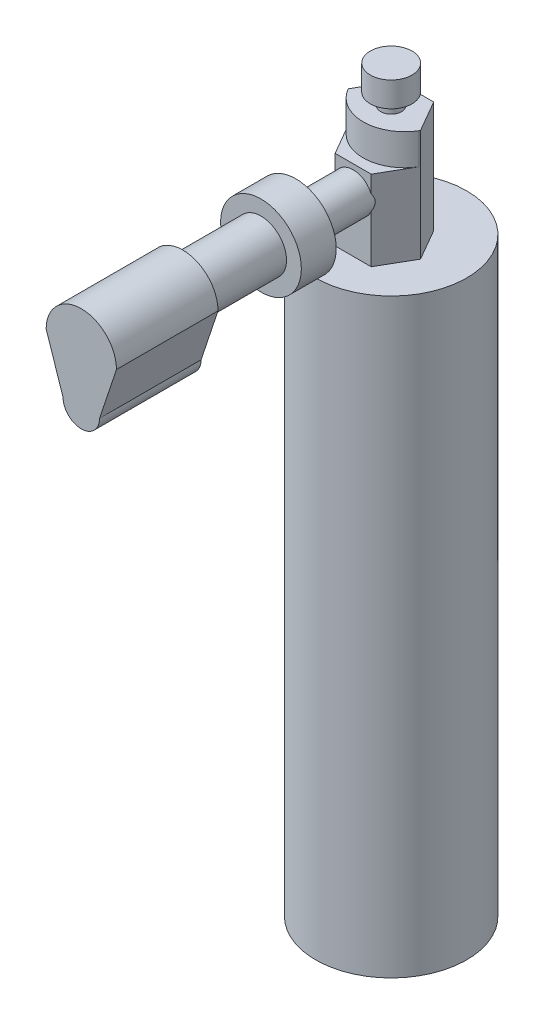
from build123d import *

# Parameters (mm, degrees)
SKETCH1_R                = 14.5
BOSS_EXTRUDE1_DEPTH      = 113.4
SKETCH2_R                = 2
BOSS_EXTRUDE2_DEPTH      = 28.5
SKETCH3_R                = 4
BOSS_EXTRUDE3_DEPTH      = 4.8
BOSS_EXTRUDE4_DEPTH      = 21.4
CUT_EXTRUDE1_DEPTH       = 6
BOSS_EXTRUDE5_DEPTH      = 11
BOSS_EXTRUDE5_DEPTH_BACK = 2
SKETCH7_R                = 3.75
SKETCH8_R                = 7.75
BOSS_EXTRUDE6_DEPTH      = 6.7
SKETCH9_R                = 4.9
BOSS_EXTRUDE7_DEPTH      = 15
BOSS_EXTRUDE8_DEPTH      = 19.5


with BuildPart() as part:
    # Sketch1 → Boss-Extrude1 (new body)
    with BuildSketch(Plane(origin=(0, 0, 0), x_dir=(1, 0, 0), z_dir=(0, 1, 0))):
        Circle(SKETCH1_R)
    extrude(amount=BOSS_EXTRUDE1_DEPTH)

    # Sketch2 → Boss-Extrude2 (add)
    with BuildSketch(Plane(origin=(0, 113.4, 0), x_dir=(1, 0, 0), z_dir=(0, 1, 0))):
        Circle(SKETCH2_R)
    extrude(amount=BOSS_EXTRUDE2_DEPTH)

    # Sketch3 → Boss-Extrude3 (add)
    with BuildSketch(Plane(origin=(0, 141.9, 0), x_dir=(1, 0, 0), z_dir=(0, 1, 0))):
        Circle(SKETCH3_R)
    extrude(amount=-BOSS_EXTRUDE3_DEPTH)

    # Sketch4 → Boss-Extrude4 (add)
    with BuildSketch(Plane(origin=(0, 113.4, 0), x_dir=(1, 0, 0), z_dir=(0, 1, 0))):
        Polygon((3.464101615, 4.7), (-3.464101615, 4.7), (-6.92820323, -1.3), (-3.464101615, -7.3), (3.464101615, -7.3), (6.92820323, -1.3), align=None)
    extrude(amount=BOSS_EXTRUDE4_DEPTH)

    # Sketch6 → Cut-Extrude1 (cut)
    with BuildSketch(Plane(origin=(0, 134.8, 0), x_dir=(1, 0, 0), z_dir=(0, 1, 0))):
        with BuildLine():
            Line((-6.92820323, -1.3), (-6.92820323, -9.46576474))
            Line((-6.92820323, -9.46576474), (6.92820323, -9.46576474))
            Line((6.92820323, -9.46576474), (6.92820323, -1.3))
            ThreePointArc((6.92820323, -1.3), (0, -5.37), (-6.92820323, -1.3))
        make_face()
    extrude(amount=-CUT_EXTRUDE1_DEPTH, mode=Mode.SUBTRACT)

    # Sketch7 → Boss-Extrude5 (add, two sides: drawn at the far end of the back side and taken through both)
    with BuildSketch(Plane.XY.offset(7.3).offset(-BOSS_EXTRUDE5_DEPTH_BACK)):
        with Locations((0, 124.05)):
            Circle(SKETCH7_R)
    extrude(amount=BOSS_EXTRUDE5_DEPTH + BOSS_EXTRUDE5_DEPTH_BACK)

    # Sketch8 → Boss-Extrude6 (add)
    with BuildSketch(Plane.XY.offset(18.3)):
        with Locations((0, 124.05)):
            Circle(SKETCH8_R)
    extrude(amount=BOSS_EXTRUDE6_DEPTH)

    # Sketch9 → Boss-Extrude7 (add)
    with BuildSketch(Plane.XY.offset(25)):
        with Locations((0, 124.05)):
            Circle(SKETCH9_R)
    extrude(amount=BOSS_EXTRUDE7_DEPTH)

    # Sketch10 → Boss-Extrude8 (add)
    with BuildSketch(Plane.XY.offset(40)):
        with BuildLine():
            Line((-6.75, 124.05), (-3.5, 114.3))
            ThreePointArc((-3.5, 114.3), (0, 110.8), (3.5, 114.3))
            Line((3.5, 114.3), (6.75, 124.05))
            ThreePointArc((6.75, 124.05), (0, 130.8), (-6.75, 124.05))
        make_face()
    extrude(amount=BOSS_EXTRUDE8_DEPTH)


solid = part.part
